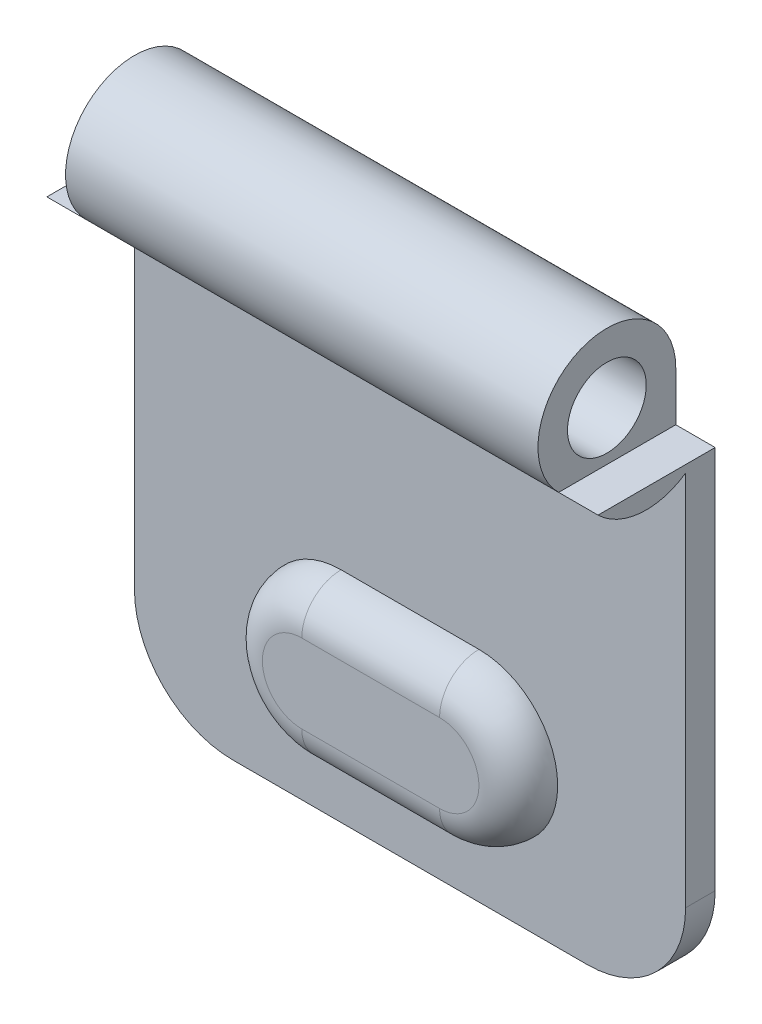
from build123d import *

# Parameters (mm, degrees)
BOSS_EXTRUDE1_DEPTH      = 14
BOSS_EXTRUDE1_DEPTH_BACK = 14
SKETCH1_R                = 2
FILLET1_R                = 5
BOSS_EXTRUDE2_DEPTH      = 2
FILLET2_R                = 2
CUT_EXTRUDE1_DEPTH       = 2
FILLET3_R                = 2
FILLET4_R                = 2
SKETCH4_W                = 2
SKETCH4_H                = 6
CUT_EXTRUDE2_DEPTH       = 32.208973069


# Some blends are built 0.0001 mm under size
with BuildPart() as part:
    # Sketch1 → Boss-Extrude1 (new, two sides: drawn at the far end of the back side and taken through both)
    with BuildSketch(Plane(origin=(0, 0, 0), x_dir=(0, 0, -1), z_dir=(1, 0, 0)).offset(-BOSS_EXTRUDE1_DEPTH_BACK)):
        with BuildLine():
            Line((3.5, 0), (3.5, -27))
            Line((3.5, -27), (2, -27))
            Line((2, -27), (2, -2.872281323))
            ThreePointArc((2, -2.872281323), (-3.102418411, 1.620185175), (3.5, 0))
        make_face()
        Circle(SKETCH1_R, mode=Mode.SUBTRACT)
    extrude(amount=BOSS_EXTRUDE1_DEPTH + BOSS_EXTRUDE1_DEPTH_BACK)

    # Fillet1
    fillet1_edges = [part.edges().sort_by_distance(p)[0] for p in [
        (-14, -27, -2.75),
        (14, -27, -2.75),
    ]]
    fillet(fillet1_edges, radius=FILLET1_R)

    # Sketch2 → Boss-Extrude2 (add)
    with BuildSketch(Plane.XY.offset(-2)):
        with BuildLine():
            Line((-3.5, -15.881230087), (3.5, -15.881230087))
            ThreePointArc((3.5, -15.881230087), (7.5, -19.881230087), (3.5, -23.881230087))
            Line((3.5, -23.881230087), (-3.5, -23.881230087))
            ThreePointArc((-3.5, -23.881230087), (-7.5, -19.881230087), (-3.5, -15.881230087))
        make_face()
    extrude(amount=BOSS_EXTRUDE2_DEPTH)

    # Fillet2
    fillet2_edges = [part.edges().sort_by_distance(p)[0] for p in [
        (-7.5, -19.881230087, 0),
        (0, -15.881230087, 0),
        (7.5, -19.881230087, 0),
        (0, -23.881230087, 0),
    ]]
    fillet(fillet2_edges, radius=FILLET2_R - 0.0001)  # a hair under: the kernel refuses the full size

    # Sketch3 → Cut-Extrude1 (cut)
    with BuildSketch(Plane(origin=(0, 0, -3.5), x_dir=(-1, 0, 0), z_dir=(0, 0, -1))):
        with BuildLine():
            Line((-4, -17.437696963), (4, -17.437696963))
            ThreePointArc((4, -17.437696963), (6.5, -19.937696963), (4, -22.437696963))
            Line((4, -22.437696963), (-4, -22.437696963))
            ThreePointArc((-4, -22.437696963), (-6.5, -19.937696963), (-4, -17.437696963))
        make_face()
    extrude(amount=-CUT_EXTRUDE1_DEPTH, mode=Mode.SUBTRACT)

    # Fillet3
    fillet3_edges = [part.edges().sort_by_distance(p)[0] for p in [
        (-6.5, -19.937696963, -1.5),
        (0, -22.437696963, -1.5),
        (6.5, -19.937696963, -1.5),
        (0, -17.437696963, -1.5),
    ]]
    fillet(fillet3_edges, radius=FILLET3_R - 0.0001)  # a hair under: the kernel refuses the full size

    # Fillet4
    # the kernel refuses this fillet: 2 mm, written as the material it takes off along each edge
    with BuildSketch(Plane(origin=(4, -19.937696963, -3.5), x_dir=(0, -1, 0), z_dir=(-1, 0, 0))) as fillet4_piece_1:
        with BuildLine():
            CenterArc((3.96414388, 2), FILLET4_R, 209.999172989, 60.000827011)
            Line((3.96414388, 0), (3.96414388, -0.2))
            Line((3.96414388, -0.2), (2.5, -0.2))
            Line((2.5, -0.2), (2.3, 0))
            ThreePointArc((2.3, 0), (2.3, 0.0001), (2.058872114, 0.900027501))
            Line((2.058872114, 0.900027501), (2.232078638, 1.000025001))
        make_face()
    revolve(axis=Axis((4, -19.937696963, -3.5), (0, 0, 1)), revolution_arc=180, mode=Mode.SUBTRACT)
    with BuildSketch(Plane(origin=(-4, -22.437696963, -3.5), x_dir=(0, 0.2587879267537998, 0.9659341638882383), z_dir=(1, 0, 0))) as fillet4_piece_2:
        with BuildLine():
            CenterArc((1.552965569, 1.931842448), FILLET4_R, 194.998154162, 60.000827011)
            Line((-0.378902759, 1.414266594), (-0.572089592, 1.362509009))
            Line((-0.572089592, 1.362509009), (-0.193186833, -0.051757585))
            Line((-0.193186833, -0.051757585), (0.051757585, -0.193186833))
            ThreePointArc((0.051757585, -0.193186833), (0.051854179, -0.193160954), (0.983525882, -0.193184245))
            Line((0.983525882, -0.193184245), (1.035293127, 0))
        make_face()
    extrude(amount=8, mode=Mode.SUBTRACT)
    with BuildSketch(Plane(origin=(-4, -19.937696963, -3.5), x_dir=(0, 1, 0), z_dir=(1, 0, 0))) as fillet4_piece_3:
        with BuildLine():
            CenterArc((3.96414388, 2), FILLET4_R, 209.999172989, 60.000827011)
            Line((2.232078638, 1.000025001), (2.058872114, 0.900027501))
            ThreePointArc((2.058872114, 0.900027501), (2.3, 0.0001), (2.3, 0))
            Line((2.3, 0), (2.5, -0.2))
            Line((2.5, -0.2), (3.96414388, -0.2))
            Line((3.96414388, -0.2), (3.96414388, 0))
        make_face()
    revolve(axis=Axis((-4, -19.937696963, -3.5), (0, 0, 1)), revolution_arc=180, mode=Mode.SUBTRACT)
    with BuildSketch(Plane(origin=(4, -17.437696963, -3.5), x_dir=(0, 1, 0), z_dir=(-1, 0, 0))) as fillet4_piece_4:
        with BuildLine():
            CenterArc((1.46414388, -2), FILLET4_R, 90, 60.000827011)
            Line((-0.267921362, -1.000025001), (-0.441127886, -0.900027501))
            ThreePointArc((-0.441127886, -0.900027501), (-0.2, -0.0001), (-0.2, 0))
            Line((-0.2, 0), (0, 0.2))
            Line((0, 0.2), (1.46414388, 0.2))
            Line((1.46414388, 0.2), (1.46414388, 0))
        make_face()
    extrude(amount=8, mode=Mode.SUBTRACT)

    # Sketch4 → Cut-Extrude2 (cut, through all)
    with BuildSketch(Plane(origin=(0, 0, -3.5), x_dir=(-1, 0, 0), z_dir=(0, 0, -1))):
        with Locations((-13, 0.5)):
            Rectangle(SKETCH4_W, SKETCH4_H)
        with Locations((13, 0.5)):
            Rectangle(SKETCH4_W, SKETCH4_H)
    extrude(amount=-CUT_EXTRUDE2_DEPTH, mode=Mode.SUBTRACT)


solid = part.part
